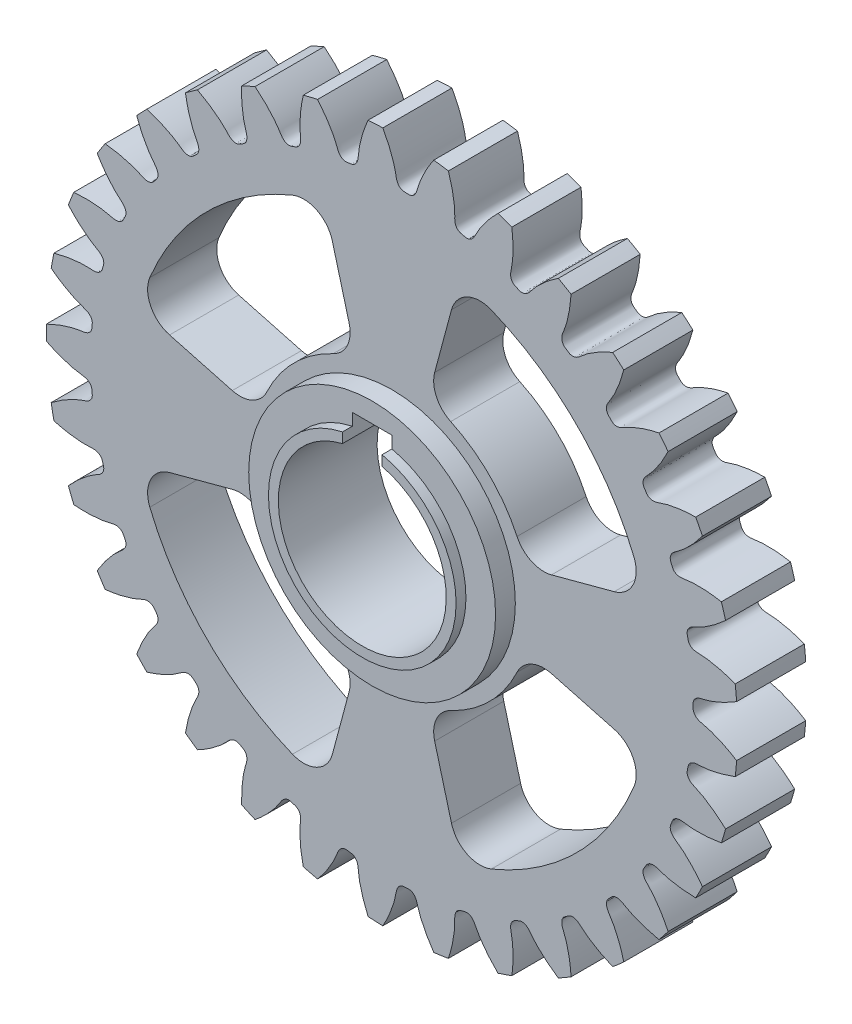
from build123d import *

# Parameters (mm, degrees)
SKETCH_399_W               = 20
SKETCH_399_H               = 34.999999474
CUT_EXTRUDE_538_DEPTH      = 10
PATTERN_CIRCULAR_594_COUNT = 33
SKETCH_641_W               = 20
SKETCH_641_H               = 5
SKETCH_5_R                 = 40
CUT_EXTRUDE_2_DEPTH        = 13
CUT_EXTRUDE_3_DEPTH        = 11
EXTRUDE_START              = 2
SKETCH_7_R                 = 12.5
EXTRUDE_1_DEPTH            = 2
EXTRUDE_START_2            = 1
EXTRUDE_2_DEPTH            = 1
CUT_EXTRUDE_4_DEPTH        = 50.981528136
FILLET_1_R                 = 3


with BuildPart() as part:
    # Sketch 399 → Revolve 426 (revolve)
    with BuildSketch(Plane(origin=(0, 0, 0), x_dir=(0, 0, -1), z_dir=(1, 0, 0))):
        with Locations((0, 17.499999737)):
            Rectangle(SKETCH_399_W, SKETCH_399_H)
    revolve(axis=Axis((0, 0, 0), (0, 0, -1)))

    # Sketch 473 → Cut-Extrude 538 (cut, symmetric)
    with BuildSketch(Plane.XY):
        with BuildLine():
            ThreePointArc((35.000278387, 2.643950801), (35.099999473, 0), (35.000278387, -2.643950801))
            add(Edge.make_bspline(
                [(35.000278387, -2.643950801), (34.790668506, -2.511673949), (34.479217319, -2.324794976), (34.065406484, -2.096518223), (33.774190663, -1.944740263), (33.495055628, -1.807552113), (33.228520074, -1.684292897), (32.975077985, -1.574285452), (32.735198602, -1.476836863), (32.509324453, -1.391241129), (32.297876064, -1.316773522), (32.101234459, -1.252713024), (31.91979726, -1.198271813), (31.753793847, -1.152829274), (31.480549178, -1.084208249), (31.219692994, -1.03876765), (30.991397756, -0.938162735), (30.888820288, -0.881565213), (30.786157744, -0.808588586), (30.683417862, -0.71067037), (30.586572953, -0.576490296), (30.518944264, -0.408298759), (30.492087674, -0.209379715), (30.50434111, 0), (30.492087674, 0.209379715), (30.518944264, 0.408298759), (30.586572953, 0.576490296), (30.683417862, 0.71067037), (30.786157744, 0.808588586), (30.888820288, 0.881565213), (30.991397756, 0.938162735), (31.219692994, 1.03876765), (31.480549178, 1.084208249), (31.753793847, 1.152829274), (31.91979726, 1.198271813), (32.101234459, 1.252713024), (32.297876064, 1.316773522), (32.509324453, 1.391241129), (32.735198602, 1.476836863), (32.975077985, 1.574285452), (33.228520074, 1.684292897), (33.495055628, 1.807552113), (33.774190663, 1.944740263), (34.065406484, 2.096518223), (34.479217319, 2.324794976), (34.790668506, 2.511673949), (35.000278387, 2.643950801)],
                knots=[0, 0, 0, 0, 0.0674204, 0.098768467, 0.128541778, 0.156740335, 0.183364135, 0.208413181, 0.231887471, 0.253787006, 0.274111785, 0.29286181, 0.310037078, 0.325637592, 0.33966335, 0.386730454, 0.396938249, 0.407387492, 0.418554548, 0.431106972, 0.445833303, 0.463233862, 0.479824905, 0.5, 0.520175095, 0.536766138, 0.554166697, 0.568893028, 0.581445452, 0.592612508, 0.603061751, 0.613269546, 0.66033665, 0.674362408, 0.689962922, 0.70713819, 0.725888215, 0.746212994, 0.768112529, 0.791586819, 0.816635865, 0.843259665, 0.871458222, 0.901231533, 0.9325796, 1, 1, 1, 1], degree=3))
        make_face()
    cut_extrude_538 = extrude(amount=CUT_EXTRUDE_538_DEPTH, both=True, mode=Mode.SUBTRACT)

    # Pattern Circular 594: Cut-Extrude 538 ×33 about axis
    pattern_circular_594_axis = Axis((0, 0, 55), (0, 0, -1))
    for i in range(1, PATTERN_CIRCULAR_594_COUNT):
        add(cut_extrude_538.rotate(pattern_circular_594_axis, i * 360 / PATTERN_CIRCULAR_594_COUNT), mode=Mode.SUBTRACT)

    # Sketch 641 → Cut-Revolve 683 (revolve, cut)
    with BuildSketch(Plane(origin=(0, 0, 0), x_dir=(0, 0, -1), z_dir=(1, 0, 0))):
        with Locations((0, 2.5)):
            Rectangle(SKETCH_641_W, SKETCH_641_H)
    revolve(axis=Axis((0, 0, 0), (0, 0, -1)), mode=Mode.SUBTRACT)

    # 草图5 → 切除-拉伸2 (cut)
    with BuildSketch(Plane.XY.offset(10)):
        Circle(SKETCH_5_R)
    extrude(amount=-CUT_EXTRUDE_2_DEPTH, mode=Mode.SUBTRACT)

    # 草图6 → 切除-拉伸3 (cut)
    with BuildSketch(Plane.XY.offset(-3)):
        with BuildLine():
            Line((2, 8.261355821), (2, 10.5))
            Line((2, 10.5), (-2, 10.5))
            Line((-2, 10.5), (-2, 8.261355821))
            ThreePointArc((-2, 8.261355821), (0, -8.5), (2, 8.261355821))
        make_face()
    extrude(amount=-CUT_EXTRUDE_3_DEPTH, mode=Mode.SUBTRACT)

    # 草图7 → 凸台-拉伸1 (add)
    with BuildSketch(Plane.XY.offset(-3).offset(EXTRUDE_START)):
        Circle(SKETCH_7_R)
        with BuildLine():
            Line((-2, 8.261355821), (-2, 10.5))
            Line((-2, 10.5), (2, 10.5))
            Line((2, 10.5), (2, 8.261355821))
            ThreePointArc((2, 8.261355821), (0, -8.5), (-2, 8.261355821))
        make_face(mode=Mode.SUBTRACT)
    extrude(amount=-EXTRUDE_1_DEPTH)

    # 草图8 → 凸台-拉伸2 (add)
    with BuildSketch(Plane.XY.offset(-1).offset(EXTRUDE_START_2)):
        with BuildLine():
            Line((2, 8.261355821), (2, 9.287087811))
            ThreePointArc((2, 9.287087811), (0, -9.5), (-2, 9.287087811))
            Line((-2, 9.287087811), (-2, 8.261355821))
            ThreePointArc((-2, 8.261355821), (0, -8.5), (2, 8.261355821))
        make_face()
    extrude(amount=-EXTRUDE_2_DEPTH)

    # 草图9 → 切除-拉伸4 (cut, through all)
    with BuildSketch(Plane.XY.offset(-3)):
        with BuildLine():
            Line((3.623466631, 13.522961568), (6.858704695, 25.597034397))
            ThreePointArc((6.858704695, 25.597034397), (18.738329701, 18.738329701), (25.597034397, 6.858704695))
            Line((25.597034397, 6.858704695), (13.522961568, 3.623466631))
            ThreePointArc((13.522961568, 3.623466631), (9.899494937, 9.899494937), (3.623466631, 13.522961568))
        make_face()
        with BuildLine():
            Line((13.522961568, -3.623466631), (25.597034397, -6.858704695))
            ThreePointArc((25.597034397, -6.858704695), (18.738329701, -18.738329701), (6.858704695, -25.597034397))
            Line((6.858704695, -25.597034397), (3.623466631, -13.522961568))
            ThreePointArc((3.623466631, -13.522961568), (9.899494937, -9.899494937), (13.522961568, -3.623466631))
        make_face()
        with BuildLine():
            Line((-3.623466631, -13.522961568), (-6.858704695, -25.597034397))
            ThreePointArc((-6.858704695, -25.597034397), (-18.738329701, -18.738329701), (-25.597034397, -6.858704695))
            Line((-25.597034397, -6.858704695), (-13.522961568, -3.623466631))
            ThreePointArc((-13.522961568, -3.623466631), (-9.899494937, -9.899494937), (-3.623466631, -13.522961568))
        make_face()
        with BuildLine():
            Line((-13.522961568, 3.623466631), (-25.597034397, 6.858704695))
            ThreePointArc((-25.597034397, 6.858704695), (-18.738329701, 18.738329701), (-6.858704695, 25.597034397))
            Line((-6.858704695, 25.597034397), (-3.623466631, 13.522961568))
            ThreePointArc((-3.623466631, 13.522961568), (-9.899494937, 9.899494937), (-13.522961568, 3.623466631))
        make_face()
    extrude(amount=-CUT_EXTRUDE_4_DEPTH, mode=Mode.SUBTRACT)

    # 圆角1
    fillet_1_edges = [part.edges().sort_by_distance(p)[0] for p in [
        (-25.597034397, 6.858704695, -6.5),
        (-13.522961568, 3.623466631, -6.5),
        (-3.623466631, 13.522961568, -6.5),
        (-6.858704695, 25.597034397, -6.5),
        (-13.522961568, -3.623466631, -6.5),
        (-25.597034397, -6.858704695, -6.5),
        (-6.858704695, -25.597034397, -6.5),
        (-3.623466631, -13.522961568, -6.5),
        (6.858704695, -25.597034397, -6.5),
        (3.623466631, -13.522961568, -6.5),
        (25.597034397, -6.858704695, -6.5),
        (13.522961568, -3.623466631, -6.5),
        (13.522961568, 3.623466631, -6.5),
        (3.623466631, 13.522961568, -6.5),
        (6.858704695, 25.597034397, -6.5),
        (25.597034397, 6.858704695, -6.5),
    ]]
    fillet(fillet_1_edges, radius=FILLET_1_R)


solid = part.part
